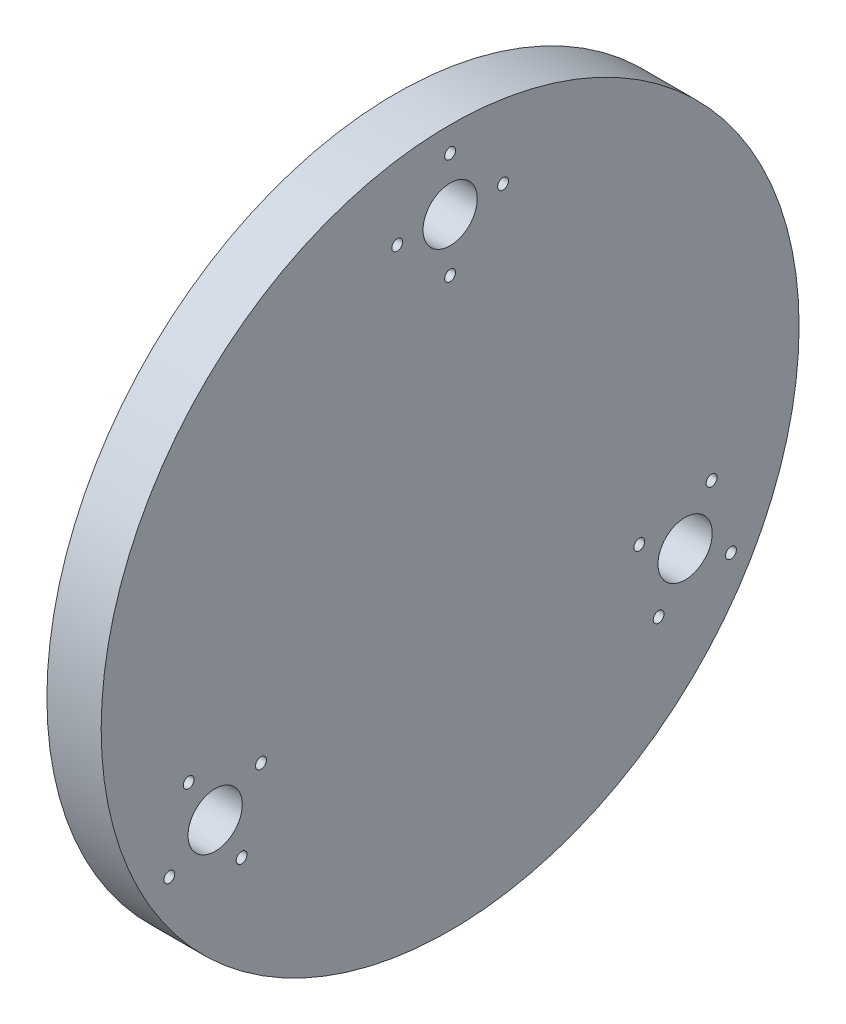
from build123d import *

# Parameters (mm, degrees)
SKETCH1_R           = 64.308589671
SKETCH1_R_2         = 1
SKETCH1_R_3         = 5
BOSS_EXTRUDE2_DEPTH = 10


with BuildPart() as part:
    # Sketch1 → Boss-Extrude2 (new body)
    with BuildSketch(Plane(origin=(0, 0, 0), x_dir=(0, 0, -1), z_dir=(1, 0, 0))):
        Circle(SKETCH1_R)
        with Locations((51.745017876, -29.875)):
            Circle(SKETCH1_R_2, mode=Mode.SUBTRACT)
        with Locations((0, 50)):
            Circle(SKETCH1_R_3, mode=Mode.SUBTRACT)
        with Locations((48.176270189, -16.556252313)):
            Circle(SKETCH1_R_2, mode=Mode.SUBTRACT)
        with Locations((43.301270189, -25)):
            Circle(SKETCH1_R_3, mode=Mode.SUBTRACT)
        with Locations((0, 59.75)):
            Circle(SKETCH1_R_2, mode=Mode.SUBTRACT)
        with Locations((9.75, 50)):
            Circle(SKETCH1_R_2, mode=Mode.SUBTRACT)
        with Locations((0, 40.25)):
            Circle(SKETCH1_R_2, mode=Mode.SUBTRACT)
        with Locations((-9.75, 50)):
            Circle(SKETCH1_R_2, mode=Mode.SUBTRACT)
        with Locations((38.426270189, -33.443747687)):
            Circle(SKETCH1_R_2, mode=Mode.SUBTRACT)
        with Locations((34.857522502, -20.125)):
            Circle(SKETCH1_R_2, mode=Mode.SUBTRACT)
        with Locations((-51.745017876, -29.875)):
            Circle(SKETCH1_R_2, mode=Mode.SUBTRACT)
        with Locations((-38.426270189, -33.443747687)):
            Circle(SKETCH1_R_2, mode=Mode.SUBTRACT)
        with Locations((-43.301270189, -25)):
            Circle(SKETCH1_R_3, mode=Mode.SUBTRACT)
        with Locations((-48.176270189, -16.556252313)):
            Circle(SKETCH1_R_2, mode=Mode.SUBTRACT)
        with Locations((-34.857522502, -20.125)):
            Circle(SKETCH1_R_2, mode=Mode.SUBTRACT)
    extrude(amount=BOSS_EXTRUDE2_DEPTH)


solid = part.part
